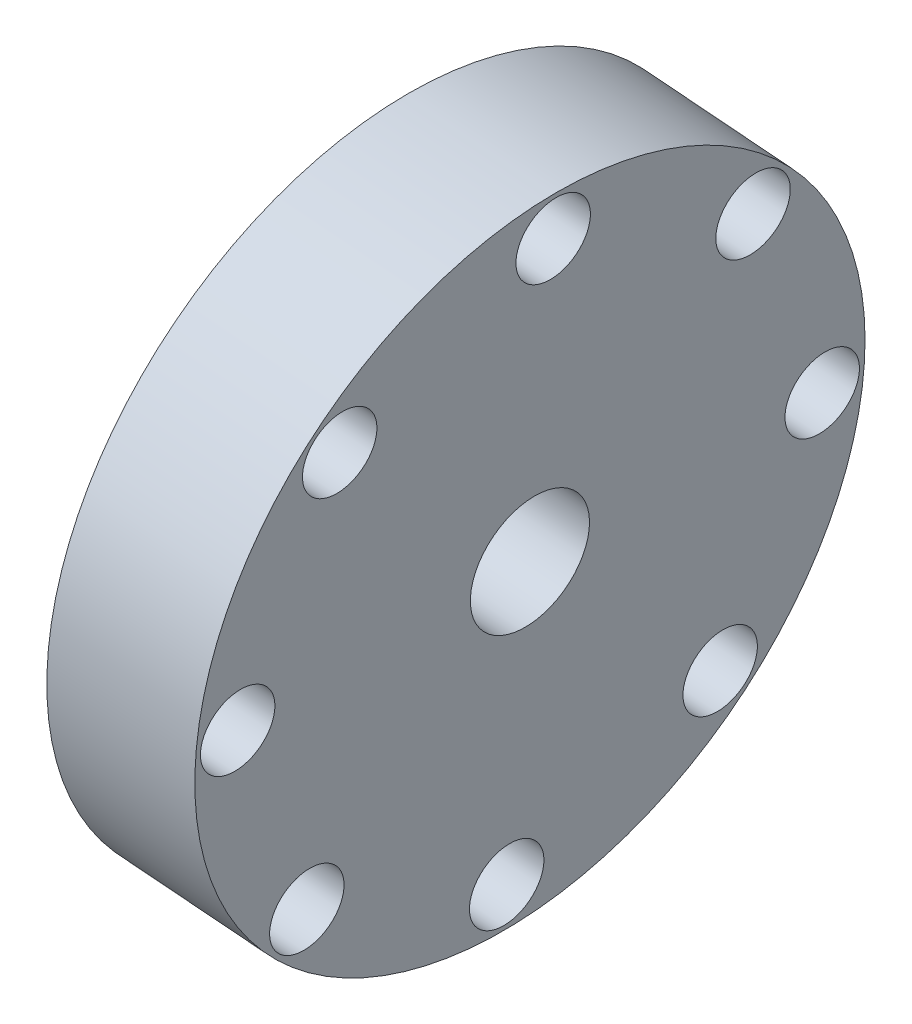
from build123d import *

# Parameters (mm, degrees)
SKETCH1_R           = 14.2875
BOSS_EXTRUDE1_DEPTH = 6.35
SKETCH2_R           = 2.54
CUT_EXTRUDE1_DEPTH  = 5.08
SKETCH3_R           = 1.5875
CUT_EXTRUDE2_DEPTH  = 10


with BuildPart() as part:
    # Sketch1 → Boss-Extrude1 (new body)
    with BuildSketch(Plane(origin=(234.278878836, -18.689027227, 0), x_dir=(0, 0, -1), z_dir=(0.9968332748770866, -0.0795199477981641, 0))):
        with Locations((-43.174261814, 8.550344032)):
            Circle(SKETCH1_R)
    extrude(amount=-BOSS_EXTRUDE1_DEPTH)

    # Sketch2 → Cut-Extrude1 (cut)
    with BuildSketch(Plane(origin=(234.278878836, -18.689027227, 0), x_dir=(0, 0, -1), z_dir=(0.9968332748770866, -0.07951994779816411, 0))):
        with Locations((-43.174261814, 8.550344032)):
            Circle(SKETCH2_R)
    extrude(amount=-CUT_EXTRUDE1_DEPTH, mode=Mode.SUBTRACT)

    # Sketch3 → Cut-Extrude2 (cut)
    with BuildSketch(Plane(origin=(227.94898754, -18.184075559, 0), x_dir=(0, 0, 1), z_dir=(-0.9968332748770866, 0.07951994779816411, 0))):
        with Locations((43.174261814, 21.050344032)):
            Circle(SKETCH3_R)
        with Locations((52.013096579, 17.389178797)):
            Circle(SKETCH3_R)
        with Locations((55.674261814, 8.550344032)):
            Circle(SKETCH3_R)
        with Locations((52.013096579, -0.288490733)):
            Circle(SKETCH3_R)
        with Locations((43.174261814, -3.949655968)):
            Circle(SKETCH3_R)
        with Locations((34.33542705, -0.288490733)):
            Circle(SKETCH3_R)
        with Locations((30.674261814, 8.550344032)):
            Circle(SKETCH3_R)
        with Locations((34.33542705, 17.389178797)):
            Circle(SKETCH3_R)
    extrude(amount=-CUT_EXTRUDE2_DEPTH, mode=Mode.SUBTRACT)


solid = part.part
